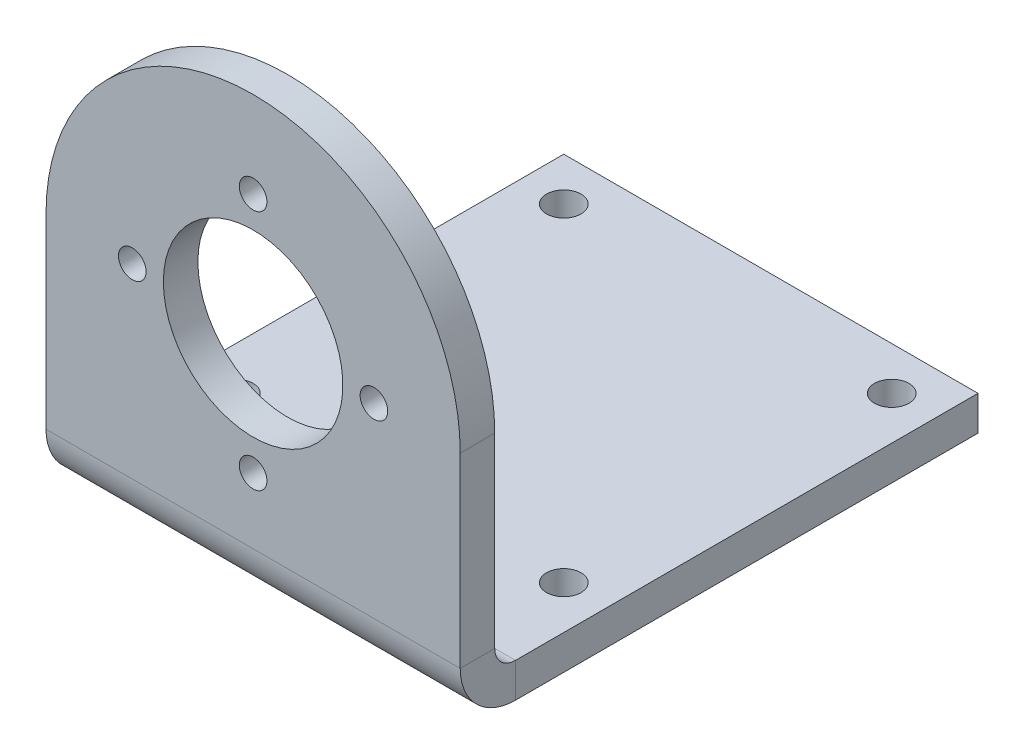
from build123d import *

# Parameters (mm, degrees)
SKETCH_10_W                      = 60
SKETCH_10_H                      = 60
SM_BASE_FLANGE_2_DEPTH           = 5
SM_EDGE_FLANGE_2_STRIP_W         = 26
SM_EDGE_FLANGE_2_STRIP_H         = 5
SM_EDGE_FLANGE_2_STRIP_CUT_DEPTH = 60
SM_EDGE_FLANGE_2_DEPTH           = 60
SKETCH_19_R                      = 2
SKETCH_19_R_2                    = 13
CUT_EXTRUDE_2_DEPTH              = 5
CUT_EXTRUDE_START                = -30
SKETCH_28_R                      = 2.5
CUT_EXTRUDE_4_DEPTH              = 5
CUT_EXTRUDE_5_DEPTH              = 5


# Sheet-metal steps are written as plain solids
with BuildPart() as part:
    # 草图10 → 基体-法兰2 (new body)
    with BuildSketch(Plane.XY):
        Rectangle(SKETCH_10_W, SKETCH_10_H)
    extrude(amount=-SM_BASE_FLANGE_2_DEPTH)

    # 边线-法兰2 strip (across the edge) → 边线-法兰2 strip cut (cut)
    with BuildSketch(Plane(origin=(30, -30, -5), x_dir=(0, 1, 0), z_dir=(-1, 0, 0))):
        with Locations((-10, -2.5)):
            Rectangle(SM_EDGE_FLANGE_2_STRIP_W, SM_EDGE_FLANGE_2_STRIP_H)
    extrude(amount=SM_EDGE_FLANGE_2_STRIP_CUT_DEPTH, mode=Mode.SUBTRACT)

    # 边线-法兰2 section (across the edge) → 边线-法兰2 (add)
    with BuildSketch(Plane(origin=(30, -30, -5), x_dir=(0, 1, 0), z_dir=(-1, 0, 0))):
        with BuildLine():
            Line((-5, 3), (-5, 70))
            Line((-5, 70), (0, 70))
            Line((0, 70), (0, 3))
            ThreePointArc((0, 3), (0.878679656, 0.878679656), (3, 0))
            Line((3, 0), (3, -5))
            ThreePointArc((3, -5), (-2.656854249, -2.656854249), (-5, 3))
        make_face()
    extrude(amount=SM_EDGE_FLANGE_2_DEPTH)

    # 草图19 → 切除-拉伸2 (cut)
    with BuildSketch(Plane.XY):
        with Locations(Location((-17.5, 0, 0), (0, 0, 180))):
            Circle(SKETCH_19_R)
        with Locations(Location((17.5, 0, 0), (0, 0, 180))):
            Circle(SKETCH_19_R)
        with Locations(Location((0, 17.5, 0), (0, 0, 180))):
            Circle(SKETCH_19_R)
        with Locations(Location((0, -17.5, 0), (0, 0, 180))):
            Circle(SKETCH_19_R)
        with Locations(Location((0, 0, 0), (0, 0, 180))):
            Circle(SKETCH_19_R_2)
    extrude(amount=-CUT_EXTRUDE_2_DEPTH, mode=Mode.SUBTRACT)

    # 草图28 → 切除-拉伸4 (cut)
    with BuildSketch(Plane(origin=(0, 0, 0), x_dir=(1, 0, 0), z_dir=(0, 1, 0)).offset(CUT_EXTRUDE_START)):
        with Locations(Location((-23.75, 21.25, 0), (0, 0, 90))):
            Circle(SKETCH_28_R)
        with Locations(Location((-23.75, 68.75, 0), (0, 0, 90))):
            Circle(SKETCH_28_R)
        with Locations(Location((23.75, 68.75, 0), (0, 0, 90))):
            Circle(SKETCH_28_R)
        with Locations(Location((23.75, 21.25, 0), (0, 0, 90))):
            Circle(SKETCH_28_R)
    extrude(amount=-CUT_EXTRUDE_4_DEPTH, mode=Mode.SUBTRACT)

    # 草图29 → 切除-拉伸5 (cut)
    with BuildSketch(Plane.XY):
        with BuildLine():
            ThreePointArc((-30, 0), (-21.213203436, 21.213203436), (0, 30))
            Line((0, 30), (-30, 30))
            Line((-30, 30), (-30, 0))
        make_face()
        with BuildLine():
            Line((30, 30), (0, 30))
            ThreePointArc((0, 30), (21.213203436, 21.213203436), (30, 0))
            Line((30, 0), (30, 30))
        make_face()
    extrude(amount=-CUT_EXTRUDE_5_DEPTH, mode=Mode.SUBTRACT)


solid = part.part
